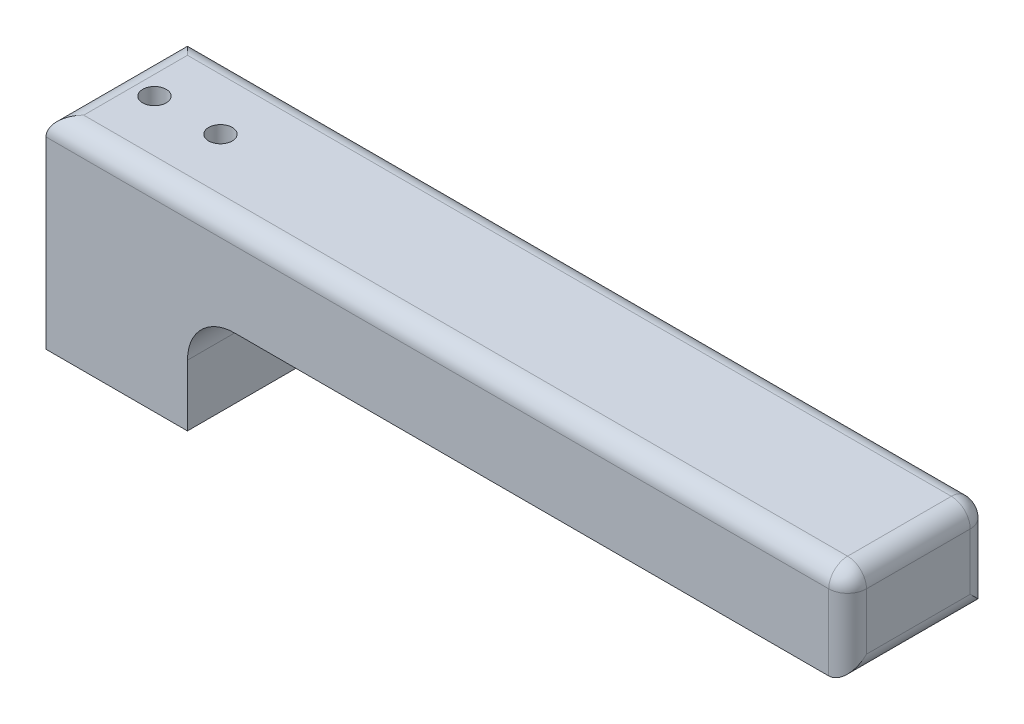
from build123d import *

# Parameters (mm, degrees)
BOSS_EXTRUDE1_DEPTH = 15
SKETCH2_R           = 1.25
CUT_EXTRUDE1_DEPTH  = 89.950829114
FILLET1_R           = 5
FILLET2_R           = 2
FILLET3_R           = 2


with BuildPart() as part:
    # Sketch1 → Boss-Extrude1 (new body)
    with BuildSketch(Plane.XY):
        Polygon((0, 0), (0, 21.5), (85, 21.5), (85, 11.5), (15, 11.5), (15, 0), align=None)
    extrude(amount=BOSS_EXTRUDE1_DEPTH)

    # Sketch2 → Cut-Extrude1 (cut, through all)
    with BuildSketch(Plane.XZ):
        with Locations((4, 7.5)):
            Circle(SKETCH2_R)
        with Locations((11, 7.5)):
            Circle(SKETCH2_R)
    extrude(amount=-CUT_EXTRUDE1_DEPTH, mode=Mode.SUBTRACT)

    # Fillet1
    fillet1_edges = [part.edges().sort_by_distance(p)[0] for p in [
        (15, 11.5, 7.5),
    ]]
    fillet(fillet1_edges, radius=FILLET1_R)

    # Fillet2
    fillet2_edges = [part.edges().sort_by_distance(p)[0] for p in [
        (85, 21.5, 7.5),
        (85, 11.5, 7.5),
        (85, 16.5, 15),
        (85, 16.5, 0),
    ]]
    fillet(fillet2_edges, radius=FILLET2_R)

    # Fillet3
    # the kernel refuses this fillet: 2 mm, written as the material it takes off along each edge
    with BuildSketch(Plane(origin=(83, 19.5, 13), x_dir=(0, 0, 1), z_dir=(0, 1, 0))) as fillet3_piece_1_section:
        Polygon((0, 0), (FILLET3_R, 0), (FILLET3_R, FILLET3_R), (0, FILLET3_R), align=None)
    fillet3_piece_1 = extrude(amount=FILLET3_R, mode=Mode.PRIVATE)
    fillet3_piece_1 = fillet3_piece_1 - Plane(origin=(83, 19.5, 13), x_dir=(-0.7071067811865475, 2.0097183471152325e-15, -0.7071067811865475), z_dir=(0, 1, 0)) * Sphere(FILLET3_R, mode=Mode.PRIVATE)
    add(fillet3_piece_1, mode=Mode.SUBTRACT)
    with BuildSketch(Plane(origin=(83, 19.5, 2), x_dir=(0, 1, 0), z_dir=(0, 0, -1))) as fillet3_piece_2_section:
        Polygon((0, 0), (FILLET3_R, 0), (FILLET3_R, FILLET3_R), (0, FILLET3_R), align=None)
    fillet3_piece_2 = extrude(amount=FILLET3_R, mode=Mode.PRIVATE)
    fillet3_piece_2 = fillet3_piece_2 - Plane(origin=(83, 19.5, 2), x_dir=(-0.7071067811865486, -0.7071067811865466, 0), z_dir=(0, 0, -1)) * Sphere(FILLET3_R, mode=Mode.PRIVATE)
    add(fillet3_piece_2, mode=Mode.SUBTRACT)
    with BuildSketch(Plane(origin=(0, 21.5, -5), x_dir=(1, 0, 0), z_dir=(0, 0, 1))) as fillet3_piece_3:
        with BuildLine():
            CenterArc((FILLET3_R, -FILLET3_R), FILLET3_R, 90, 90)
            Line((0, -FILLET3_R), (0, 0))
            Line((0, 0), (FILLET3_R, 0))
        make_face()
    extrude(amount=25, mode=Mode.SUBTRACT)
    with BuildSketch(Plane(origin=(-5, 21.5, 0), x_dir=(0, -1, 0), z_dir=(1, 0, 0)), Plane(origin=(-5, 21.5, 15), x_dir=(0, 0, -1), z_dir=(1, 0, 0))) as fillet3_piece_4:
        with BuildLine():
            CenterArc((FILLET3_R, -FILLET3_R), FILLET3_R, 90, 90)
            Line((0, -FILLET3_R), (0, 0))
            Line((0, 0), (FILLET3_R, 0))
        make_face()
    extrude(amount=88, mode=Mode.SUBTRACT)


solid = part.part
